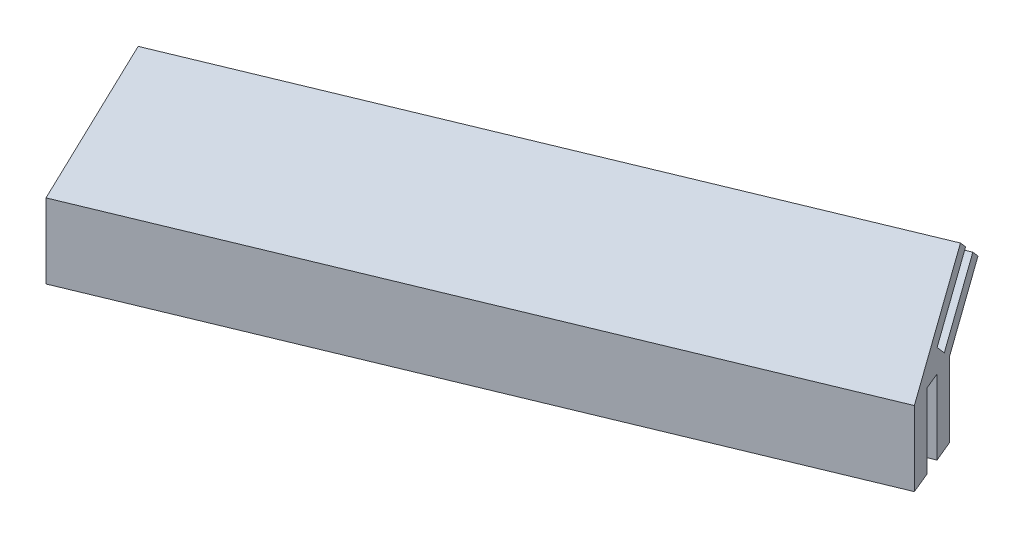
from build123d import *

# Parameters (mm, degrees)
SKETCH1_W           = 214.089522673
SKETCH1_H           = 271.033566845
BOSS_EXTRUDE1_DEPTH = 10
SKETCH3_W           = 107.044761337
SKETCH3_H           = 271.033566845
CUT_EXTRUDE1_DEPTH  = 252.253590179
CUT_EXTRUDE2_DEPTH  = 249.55642867
BOSS_EXTRUDE3_DEPTH = 40
CUT_EXTRUDE3_START  = -165.689856025
CUT_EXTRUDE3_DEPTH  = 205.862728092
CUT_EXTRUDE4_DEPTH  = 250.960593361
CUT_EXTRUDE5_DEPTH  = 250.960593361
BOSS_EXTRUDE5_DEPTH = 45
CUT_EXTRUDE7_DEPTH  = 253.784190336
CUT_EXTRUDE9_DEPTH  = 253.784190336
CUT_EXTRUDE10_DEPTH = 253.784190336
BOSS_EXTRUDE6_DEPTH = 13.546139965


with BuildPart() as part:
    # Sketch1 → Boss-Extrude1 (new body)
    with BuildSketch(Plane(origin=(0, 0, 0), x_dir=(1, 0, 0), z_dir=(0, 1, 0))):
        with Locations((-3.148375333, -90.062114546)):
            Rectangle(SKETCH1_W, SKETCH1_H)
    extrude(amount=BOSS_EXTRUDE1_DEPTH)

    # Sketch3 → Cut-Extrude1 (cut, through all)
    with BuildSketch(Plane(origin=(0, 10, 0), x_dir=(1, 0, 0), z_dir=(0, 1, 0))):
        with Locations((-56.670756002, -90.062114546)):
            Rectangle(SKETCH3_W, SKETCH3_H)
    extrude(amount=-CUT_EXTRUDE1_DEPTH, mode=Mode.SUBTRACT)

    # Sketch4 → Cut-Extrude2 (cut, through all)
    with BuildSketch(Plane(origin=(0, 10, 0), x_dir=(1, 0, 0), z_dir=(0, 1, 0))):
        Polygon((103.896386003, -181.239506042), (100.834918545, -173.848469781), (9.996584241, 45.454668877), (103.896386003, 45.454668877), align=None)
    extrude(amount=-CUT_EXTRUDE2_DEPTH, mode=Mode.SUBTRACT)

    # Sketch6 → Boss-Extrude3 (add, along a direction that is not the sketch's normal)
    with BuildSketch(Plane(origin=(0, 10, 0), x_dir=(1, 0, 0), z_dir=(0, 1, 0))):
        Polygon((99.572063218, -170.799667324), (103.896386003, -181.239506042), (-3.148375333, -225.578897968), (-3.148375333, -213.347866105), align=None)
    extrude(amount=BOSS_EXTRUDE3_DEPTH, dir=(-0.2705980500730979, 0.7071067811865489, -0.6532814824381872))

    # Cut-Extrude3: read off the stored shape, not the designer's step
    # Cut-Extrude3 outline → Cut-Extrude3 (cut)
    with BuildSketch(Plane(origin=(0, 0, 0), x_dir=(1, 0, 0), z_dir=(0, 0.6785983445458481, -0.7345095552677544)).offset(CUT_EXTRUDE3_START)):
        Polygon((-3.148375333, -165), (-3.148375333, -152.122604304), (-13.972297336, -155.165042499), (-15, -155.45391393), (-15, -165), align=None)
    extrude(amount=CUT_EXTRUDE3_DEPTH, mode=Mode.SUBTRACT)

    # Sketch8 → Cut-Extrude4 (cut, through all)
    with BuildSketch(Plane(origin=(0, 10, 0), x_dir=(1, 0, 0), z_dir=(0, 1, 0))):
        Polygon((-3.148375333, -225.578897968), (103.896386003, -181.239506042), (103.896386003, -225.578897968), align=None)
    extrude(amount=-CUT_EXTRUDE4_DEPTH, mode=Mode.SUBTRACT)

    # Sketch9 → Cut-Extrude5 (cut, through all)
    with BuildSketch(Plane(origin=(0, 10, 0), x_dir=(1, 0, 0), z_dir=(0, 1, 0))):
        Polygon((-3.148375333, -213.347866105), (99.572063218, -170.799667324), (9.996584241, 45.454668877), (-3.148375333, 45.454668877), align=None)
    extrude(amount=-CUT_EXTRUDE5_DEPTH, mode=Mode.SUBTRACT)

    # Sketch13 → Boss-Extrude5 (add)
    with BuildSketch(Plane.XZ):
        Polygon((-3.148375333, 225.578897968), (-3.148375333, 213.347866105), (99.572063218, 170.799667324), (103.896386003, 181.239506042), align=None)
    extrude(amount=BOSS_EXTRUDE5_DEPTH)

    # Sketch14 → Cut-Extrude7 (cut, through all)
    with BuildSketch(Plane(origin=(24.603270673, 0, -10.191008392), x_dir=(-0.38268343236508967, 0, -0.9238795325112868), z_dir=(0.9238795325112867, 0, -0.3826834323650896))):
        Polygon((-178.918624473, 38.284271247), (-173.268624473, 32.634271247), (-167.618624473, 38.284271247), align=None)
    extrude(amount=-CUT_EXTRUDE7_DEPTH, mode=Mode.SUBTRACT)

    # Sketch21 → Cut-Extrude9 (cut, through all)
    with BuildSketch(Plane(origin=(24.603270673, 0, -10.191008392), x_dir=(-0.38268343236508967, 0, -0.9238795325112868), z_dir=(0.9238795325112867, 0, -0.3826834323650896))):
        Polygon((-178.918624473, 38.284271247), (-173.268624473, 32.634271247), (-186.710507565, 19.192388155), (-188.372208501, 20.854089091), (-197.564596656, 11.661700936), (-199.891194785, 13.988299064), (-190.698806629, 23.18068722), (-192.360507565, 24.842388155), align=None)
    extrude(amount=-CUT_EXTRUDE9_DEPTH, mode=Mode.SUBTRACT)

    # Sketch23 → Cut-Extrude10 (cut, through all)
    with BuildSketch(Plane(origin=(24.603270673, 0, -10.191008392), x_dir=(-0.38268343236508967, 0, -0.9238795325112868), z_dir=(0.9238795325112867, 0, -0.3826834323650896))):
        Polygon((-207.20289572, -3), (-203.20289572, -3), (-203.20289572, 10), (-199.90289572, 10), (-199.90289572, -3), (-195.90289572, -3), (-195.90289572, -45), (-207.20289572, -45), align=None)
    extrude(amount=-CUT_EXTRUDE10_DEPTH, mode=Mode.SUBTRACT)

    # Sketch24 → Boss-Extrude6 (add, along a direction that is not the sketch's normal)
    with BuildSketch(Plane(origin=(35.57097911, -92.95144786, 85.875940195), x_dir=(0.9626924198811571, 0.19875685341551327, -0.18362738881693624), z_dir=(-0.2705980500730966, 0.7071067811865525, -0.6532814824381838))):
        Polygon((-40.219860097, -165.940754997), (-40.219860097, -169.369289928), (-38.335322468, -168.817321636), (-39.260177115, -165.659670359), align=None)
    extrude(amount=BOSS_EXTRUDE6_DEPTH, dir=(0, 0.6785983445458494, -0.7345095552677533))


solid = part.part
